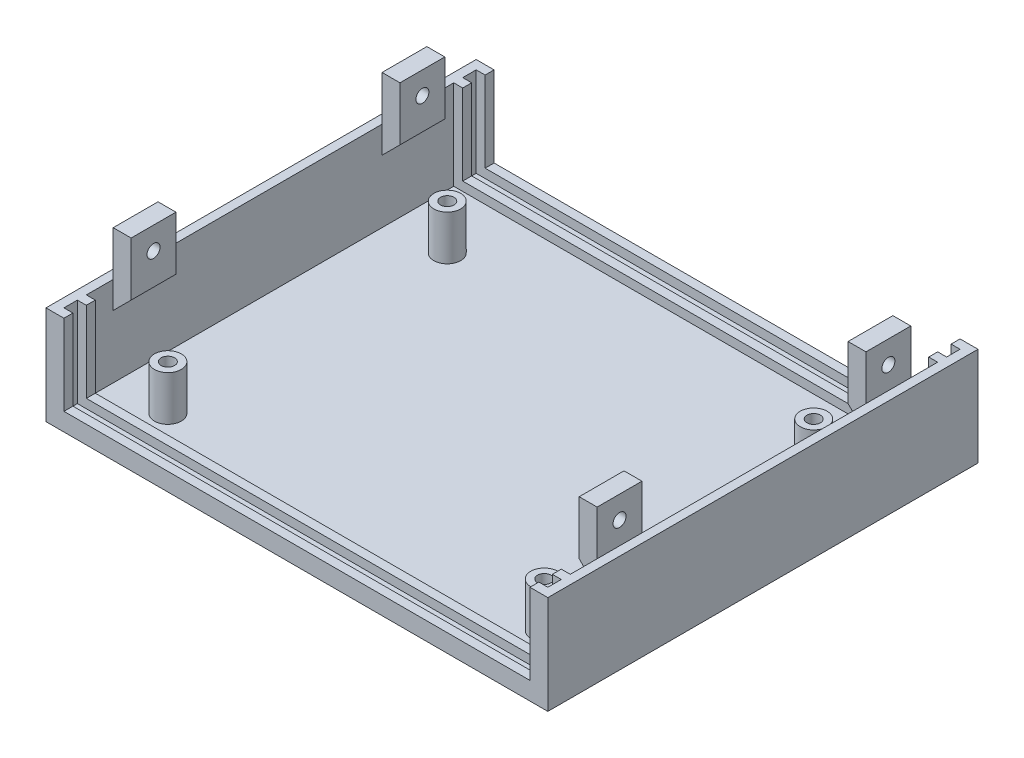
from build123d import *

# Parameters (mm, degrees)
ESBO_O1_W                = 112
ESBO_O1_H                = 96
RESSALTO_EXTRUS_O1_DEPTH = 2
ESBO_O2_W                = 2
ESBO_O2_H                = 96
RESSALTO_EXTRUS_O2_DEPTH = 20
ESBO_O3_W                = 108
ESBO_O3_H                = 2
RESSALTO_EXTRUS_O3_DEPTH = 20
ESBO_O5_W                = 104
ESBO_O5_H                = 18
CORTE_EXTRUS_O1_DEPTH    = 150.1442255
ESBO_O6_R                = 3
RESSALTO_EXTRUS_O4_DEPTH = 10
ESBO_O7_R                = 1.5
CORTE_EXTRUS_O2_DEPTH    = 10
ESBO_O8_W                = 10
ESBO_O8_H                = 16
RESSALTO_EXTRUS_O5_DEPTH = 4
ESBO_O9_W                = 10
ESBO_O9_H                = 16
RESSALTO_EXTRUS_O6_DEPTH = 4
ESBO_O10_R               = 1.45
CORTE_EXTRUS_O3_DEPTH    = 150.465715132
CHANFRO2_SIZE            = 4


with BuildPart() as part:
    # Esboço1 → Ressalto-extrusão1 (new body)
    with BuildSketch(Plane(origin=(0, 0, 0), x_dir=(1, 0, 0), z_dir=(0, 1, 0))):
        with Locations((56, 48)):
            Rectangle(ESBO_O1_W, ESBO_O1_H)
    extrude(amount=RESSALTO_EXTRUS_O1_DEPTH)

    # Esboço2 → Ressalto-extrusão2 (add)
    with BuildSketch(Plane(origin=(0, 2, 0), x_dir=(1, 0, 0), z_dir=(0, 1, 0))):
        with Locations((1, 48)):
            Rectangle(ESBO_O2_W, ESBO_O2_H)
        with Locations((111, 48)):
            Rectangle(ESBO_O2_W, ESBO_O2_H)
    extrude(amount=RESSALTO_EXTRUS_O2_DEPTH)

    # Esboço3 → Ressalto-extrusão3 (add)
    with BuildSketch(Plane(origin=(0, 2, 0), x_dir=(1, 0, 0), z_dir=(0, 1, 0))):
        with Locations((56, 95)):
            Rectangle(ESBO_O3_W, ESBO_O3_H)
        with Locations((56, 1)):
            Rectangle(ESBO_O3_W, ESBO_O3_H)
        with Locations((56, 90)):
            Rectangle(ESBO_O3_W, ESBO_O3_H)
        with Locations((56, 6)):
            Rectangle(ESBO_O3_W, ESBO_O3_H)
    extrude(amount=RESSALTO_EXTRUS_O3_DEPTH)

    # Esboço5 → Corte-extrusão1 (cut, through all)
    with BuildSketch(Plane.XY):
        with Locations((56, 13)):
            Rectangle(ESBO_O5_W, ESBO_O5_H)
    extrude(amount=-CORTE_EXTRUS_O1_DEPTH, mode=Mode.SUBTRACT)

    # Esboço6 → Ressalto-extrusão4 (add)
    with BuildSketch(Plane(origin=(0, 2, 0), x_dir=(1, 0, 0), z_dir=(0, 1, 0))):
        with Locations(Location((98, 13.2, 0), (0, 0, 90))):
            Circle(ESBO_O6_R)
        with Locations(Location((14, 13.2, 0), (0, 0, 90))):
            Circle(ESBO_O6_R)
        with Locations(Location((97.143041423, 74.193980211, 0), (0, 0, 90))):
            Circle(ESBO_O6_R)
        with Locations(Location((14.151803836, 75.4, 0), (0, 0, 90))):
            Circle(ESBO_O6_R)
    extrude(amount=RESSALTO_EXTRUS_O4_DEPTH)

    # Esboço7 → Corte-extrusão2 (cut)
    with BuildSketch(Plane(origin=(0, 12, 0), x_dir=(1, 0, 0), z_dir=(0, 1, 0))):
        with Locations(Location((14.151803836, 75.4, 0), (0, 0, 270))):
            Circle(ESBO_O7_R)
        with Locations(Location((97.143041423, 74.193980211, 0), (0, 0, 270))):
            Circle(ESBO_O7_R)
        with Locations(Location((98, 13.2, 0), (0, 0, 270))):
            Circle(ESBO_O7_R)
        with Locations(Location((14, 13.2, 0), (0, 0, 270))):
            Circle(ESBO_O7_R)
    extrude(amount=-CORTE_EXTRUS_O2_DEPTH, mode=Mode.SUBTRACT)

    # Esboço8 → Ressalto-extrusão5 (add)
    with BuildSketch(Plane.ZY.offset(-110)):
        with Locations((-78, 24)):
            Rectangle(ESBO_O8_W, ESBO_O8_H)
        with Locations((-18, 24)):
            Rectangle(ESBO_O8_W, ESBO_O8_H)
    extrude(amount=RESSALTO_EXTRUS_O5_DEPTH)

    # Esboço9 → Ressalto-extrusão6 (add)
    with BuildSketch(Plane(origin=(2, 0, 0), x_dir=(0, 0, -1), z_dir=(1, 0, 0))):
        with Locations((18, 24)):
            Rectangle(ESBO_O9_W, ESBO_O9_H)
        with Locations((78, 24)):
            Rectangle(ESBO_O9_W, ESBO_O9_H)
    extrude(amount=RESSALTO_EXTRUS_O6_DEPTH)

    # Esboço10 → Corte-extrusão3 (cut, through all)
    with BuildSketch(Plane(origin=(110, 0, 0), x_dir=(0, 0, -1), z_dir=(1, 0, 0))):
        with Locations((18, 27)):
            Circle(ESBO_O10_R)
        with Locations((78, 27)):
            Circle(ESBO_O10_R)
    extrude(amount=-CORTE_EXTRUS_O3_DEPTH, mode=Mode.SUBTRACT)

    # Chanfro2
    chanfro2_edges = [part.edges().sort_by_distance(p)[0] for p in [
        (106, 16, -18),
        (106, 16, -78),
        (6, 16, -78),
        (6, 16, -18),
    ]]
    chamfer(chanfro2_edges, length=CHANFRO2_SIZE - 0.0001)  # a hair under: the kernel refuses the full size


solid = part.part
